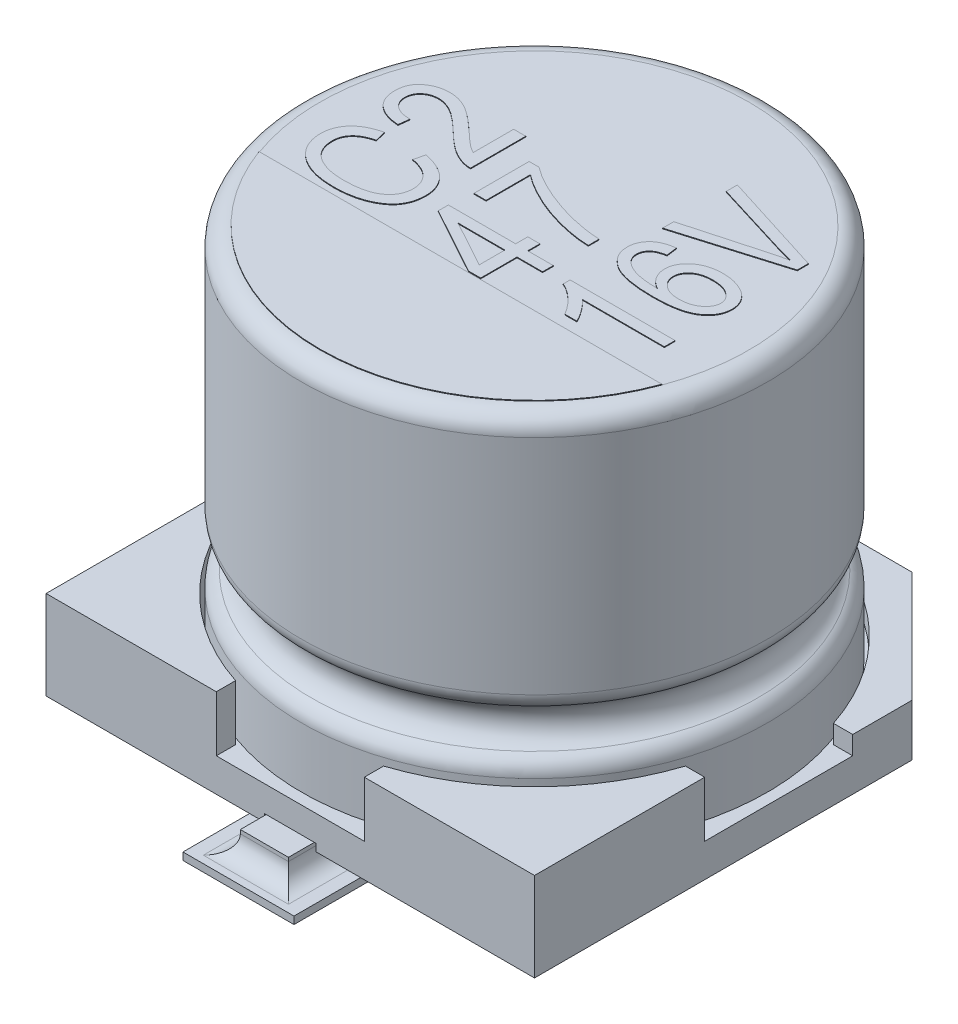
from build123d import *

# Parameters (mm, degrees)
SKETCH1_W                = 6.6
SKETCH1_H                = 6.6
BOSS_EXTRUDE1_DEPTH      = 1.2
CUT_EXTRUDE1_DEPTH       = 0.75
CUT_EXTRUDE2_DEPTH       = 5.902040392
CUT_EXTRUDE2_DEPTH_BACK  = 5.902040392
SKETCH3_W                = 3.3
SKETCH3_H                = 0.5
CHAMFER1_SIZE            = 1.5
CUT_EXTRUDE3_DEPTH       = 0.1
BOSS_EXTRUDE4_DEPTH      = 0.3
BOSS_EXTRUDE4_DEPTH_BACK = 0.1
SKETCH8_R                = 0.5
BOSS_EXTRUDE5_DEPTH      = 0.3
SKETCH9_W                = 1.5
SKETCH9_H                = 2
BOSS_EXTRUDE6_DEPTH      = 0.1
FILLET1_R                = 0.25
BOSS_EXTRUDE7_DEPTH      = 0.01


with BuildPart() as part:
    # Sketch1 → Boss-Extrude1 (new body)
    with BuildSketch(Plane(origin=(0, 0.3, 0), x_dir=(1, 0, 0), z_dir=(0, 1, 0))):
        Rectangle(SKETCH1_W, SKETCH1_H)
    extrude(amount=BOSS_EXTRUDE1_DEPTH)

    # Sketch2 → Cut-Extrude1 (cut)
    with BuildSketch(Plane(origin=(0, 1.5, 0), x_dir=(1, 0, 0), z_dir=(0, 1, 0))):
        with BuildLine():
            Line((-3.3, 1), (-3.039736831, 1))
            ThreePointArc((-3.039736831, 1), (-2.2627417, 2.2627417), (-1, 3.039736831))
            Line((-1, 3.039736831), (-1, 3.3))
            Line((-1, 3.3), (1, 3.3))
            Line((1, 3.3), (1, 3.039736831))
            ThreePointArc((1, 3.039736831), (2.2627417, 2.2627417), (3.039736831, 1))
            Line((3.039736831, 1), (3.3, 1))
            Line((3.3, 1), (3.3, -1))
            Line((3.3, -1), (3.039736831, -1))
            ThreePointArc((3.039736831, -1), (2.2627417, -2.2627417), (1, -3.039736831))
            Line((1, -3.039736831), (1, -3.3))
            Line((1, -3.3), (-1, -3.3))
            Line((-1, -3.3), (-1, -3.039736831))
            ThreePointArc((-1, -3.039736831), (-2.2627417, -2.2627417), (-3.039736831, -1))
            Line((-3.039736831, -1), (-3.3, -1))
            Line((-3.3, -1), (-3.3, 1))
        make_face()
    extrude(amount=-CUT_EXTRUDE1_DEPTH, mode=Mode.SUBTRACT)

    # Sketch3 → Cut-Extrude2 (cut, two sides: drawn at the far end of the back side and taken through both)
    with BuildSketch(Plane(origin=(0, 0, 0), x_dir=(0, 0, -1), z_dir=(1, 0, 0)).offset(-CUT_EXTRUDE2_DEPTH_BACK)):
        with Locations((1.65, 1.25)):
            Rectangle(SKETCH3_W, SKETCH3_H)
    extrude(amount=CUT_EXTRUDE2_DEPTH + CUT_EXTRUDE2_DEPTH_BACK, mode=Mode.SUBTRACT)

    # Chamfer1
    chamfer1_edges = [part.edges().sort_by_distance(p)[0] for p in [
        (-3.3, 0.65, -3.3),
        (3.3, 0.65, -3.3),
    ]]
    chamfer(chamfer1_edges, length=CHAMFER1_SIZE)

    # Sketch7 → Cut-Extrude3 (cut)
    with BuildSketch(Plane.XZ.offset(-0.3)):
        with BuildLine():
            Line((-0.35, 3.3), (0.35, 3.3))
            Line((0.35, 3.3), (0.498675617, 1.261367968))
            ThreePointArc((0.498675617, 1.261367968), (0, 0.725), (-0.498675617, 1.261367968))
            Line((-0.498675617, 1.261367968), (-0.35, 3.3))
        make_face()
        with BuildLine():
            Line((-0.35, -3.3), (0.35, -3.3))
            Line((0.35, -3.3), (0.498675617, -1.261367968))
            ThreePointArc((0.498675617, -1.261367968), (0, -0.725), (-0.498675617, -1.261367968))
            Line((-0.498675617, -1.261367968), (-0.35, -3.3))
        make_face()
    extrude(amount=-CUT_EXTRUDE3_DEPTH, mode=Mode.SUBTRACT)

    # Sketch6 → Boss-Extrude4 (add, two sides: drawn at the far end of the back side and taken through both)
    with BuildSketch(Plane.XZ.offset(-0.3).offset(-BOSS_EXTRUDE4_DEPTH_BACK)):
        with BuildLine():
            Line((-0.325, -1.225), (-0.325, -3.65))
            Line((-0.325, -3.65), (0.325, -3.65))
            Line((0.325, -3.65), (0.325, -1.225))
            ThreePointArc((0.325, -1.225), (0, -0.9), (-0.325, -1.225))
        make_face()
        with BuildLine():
            Line((-0.325, 1.225), (-0.325, 3.65))
            Line((-0.325, 3.65), (0.325, 3.65))
            Line((0.325, 3.65), (0.325, 1.225))
            ThreePointArc((0.325, 1.225), (0, 0.9), (-0.325, 1.225))
        make_face()
    extrude(amount=BOSS_EXTRUDE4_DEPTH + BOSS_EXTRUDE4_DEPTH_BACK)

    # Sketch8 → Boss-Extrude5 (add)
    with BuildSketch(Plane.XZ.offset(-0.3)):
        with Locations((-2, 2)):
            Circle(SKETCH8_R)
        with Locations((2, 2)):
            Circle(SKETCH8_R)
        with Locations((2, -2)):
            Circle(SKETCH8_R)
        with Locations((-2, -2)):
            Circle(SKETCH8_R)
    extrude(amount=BOSS_EXTRUDE5_DEPTH)

    # Sketch9 → Boss-Extrude6 (add)
    with BuildSketch(Plane(origin=(0, 0, 0), x_dir=(1, 0, 0), z_dir=(0, 1, 0))):
        with Locations((0, 3)):
            Rectangle(SKETCH9_W, SKETCH9_H)
        with Locations((0, -3)):
            Rectangle(SKETCH9_W, SKETCH9_H)
    extrude(amount=BOSS_EXTRUDE6_DEPTH)

    # Fillet1
    fillet1_edges = [part.edges().sort_by_distance(p)[0] for p in [
        (-0.325, 0.1, -2.825),
        (0, 0.1, -3.65),
        (0.325, 0.1, -2.825),
        (-0.325, 0.1, 2.825),
        (0.325, 0.1, 2.825),
        (0, 0.1, 3.65),
    ]]
    fillet(fillet1_edges, radius=FILLET1_R)


with BuildPart() as body_2:
    # Sketch4 → Revolve1 (revolve)
    with BuildSketch(Plane(origin=(0, 0, 0), x_dir=(0, 0, -1), z_dir=(1, 0, 0))):
        with BuildLine():
            Line((0, 0.75), (0, 5.8))
            Line((0, 5.8), (-2.9, 5.8))
            ThreePointArc((-2.9, 5.8), (-3.076776695, 5.726776695), (-3.15, 5.55))
            Line((-3.15, 5.55), (-3.15, 2.539897949))
            ThreePointArc((-3.15, 2.539897949), (-3.113200716, 2.409339707), (-3.013636364, 2.317217063))
            ThreePointArc((-3.013636364, 2.317217063), (-2.85, 2.05), (-3.013636364, 1.782782937))
            ThreePointArc((-3.013636364, 1.782782937), (-3.113200716, 1.690660293), (-3.15, 1.560102051))
            Line((-3.15, 1.560102051), (-3.15, 0.75))
            Line((-3.15, 0.75), (0, 0.75))
        make_face()
    revolve(axis=Axis((0, 0, 0), (0, 1, 0)))

    # Sketch10 → Boss-Extrude7 (add)
    # profile 1 of 8: a face of its own
    with BuildSketch(Plane(origin=(0, 5.8, 0), x_dir=(1, 0, 0), z_dir=(0, 1, 0))):
        with BuildLine():
            Line((-2.722131518, -1), (2.722131518, -1))
            ThreePointArc((2.722131518, -1), (0, -2.9), (-2.722131518, -1))
        make_face()
    # profile 2 of 8: a face of its own
    with BuildSketch(Plane(origin=(0, 5.8, 0), x_dir=(1, 0, 0), z_dir=(0, 1, 0))):
        with BuildLine():
            Line((-1.590909091, -0.054545455), (-1.554545455, 0.090909091))
            add(Edge.make_bspline(
                [(-1.554545455, 0.090909091), (-1.535269984, 0.086573907), (-1.497690858, 0.078122106), (-1.443641016, 0.062267336), (-1.39347407, 0.043748021), (-1.347020443, 0.023039775), (-1.304271779, 0.000124477), (-1.26542753, -0.02529249), (-1.230157415, -0.052859494), (-1.199022696, -0.0830881), (-1.1711564, -0.11498153), (-1.147359527, -0.148885394), (-1.126876496, -0.184353775), (-1.110494381, -0.221648338), (-1.097542958, -0.26053486), (-1.088602603, -0.301197149), (-1.082613039, -0.343476895), (-1.082085319, -0.372327427), (-1.081818182, -0.386931818)],
                knots=[0, 0, 0, 0, 1.289353086, 2.513700628, 3.673385124, 4.777321585, 5.831023157, 6.835648429, 7.803886002, 8.748111141, 9.663929382, 10.564264807, 11.447463292, 12.332994627, 13.21843967, 14.118159583, 15.047395907, 16, 16, 16, 16], degree=3))
            add(Edge.make_bspline(
                [(-1.081818182, -0.386931818), (-1.08199604, -0.399821435), (-1.082344685, -0.425088107), (-1.08628588, -0.462271509), (-1.092042775, -0.49811477), (-1.100709737, -0.532535089), (-1.111320422, -0.565607629), (-1.12494552, -0.597015472), (-1.140459369, -0.627260099), (-1.158765073, -0.656028269), (-1.179571172, -0.683485815), (-1.203389889, -0.709483177), (-1.230089597, -0.734193803), (-1.259944493, -0.757429014), (-1.292153583, -0.780002615), (-1.327732387, -0.800693244), (-1.366087752, -0.820236254), (-1.407117451, -0.838589504), (-1.450494312, -0.855557658), (-1.496291355, -0.869438478), (-1.543730677, -0.881811406), (-1.593174601, -0.891633014), (-1.644419194, -0.899736152), (-1.697742163, -0.904867658), (-1.752885478, -0.90849447), (-1.79033462, -0.908889873), (-1.809375, -0.909090909)],
                knots=[0, 0, 0, 0, 0.921073667, 1.805520506, 2.670265093, 3.514196551, 4.340540458, 5.150330323, 5.958760814, 6.76821105, 7.584651584, 8.418448886, 9.285522186, 10.182088649, 11.121025464, 12.095129432, 13.121488672, 14.19720655, 15.30730909, 16.448576387, 17.61598683, 18.810867686, 20.050753221, 21.323199669, 22.639026301, 24, 24, 24, 24], degree=3))
            add(Edge.make_bspline(
                [(-1.809375, -0.909090909), (-1.828131477, -0.908891515), (-1.864918777, -0.908500442), (-1.918927074, -0.904879558), (-1.970836199, -0.89976115), (-2.020467971, -0.891629314), (-2.068038414, -0.881875407), (-2.113230745, -0.869546812), (-2.156417451, -0.855465065), (-2.197183074, -0.838717593), (-2.23556886, -0.819854437), (-2.271703348, -0.799665669), (-2.305636674, -0.7782885), (-2.336754909, -0.754647483), (-2.365716723, -0.729906308), (-2.392050099, -0.703226401), (-2.415889386, -0.675051379), (-2.437612676, -0.645533861), (-2.456445194, -0.614609234), (-2.473168151, -0.582906747), (-2.487044041, -0.550190169), (-2.498446352, -0.516578306), (-2.507309721, -0.482103804), (-2.51340371, -0.446753631), (-2.517701953, -0.410616822), (-2.518020918, -0.386187094), (-2.518181818, -0.373863636)],
                knots=[0, 0, 0, 0, 1.355026576, 2.657629592, 3.909672378, 5.122282177, 6.289750101, 7.416737124, 8.50507279, 9.569838826, 10.598010427, 11.593540646, 12.559644741, 13.492918072, 14.414658006, 15.309728197, 16.19807831, 17.079418121, 17.954841938, 18.811754048, 19.667052977, 20.519555819, 21.374197669, 22.235876869, 23.110096619, 24, 24, 24, 24], degree=3))
            add(Edge.make_bspline(
                [(-2.518181818, -0.373863636), (-2.517836245, -0.360403658), (-2.517157421, -0.333963692), (-2.51232314, -0.2949276), (-2.50375071, -0.257491322), (-2.491963894, -0.221400738), (-2.477319506, -0.186648435), (-2.458926486, -0.153497861), (-2.437231843, -0.121829676), (-2.412151492, -0.091753334), (-2.384064112, -0.063268457), (-2.352642727, -0.037053667), (-2.318021615, -0.013198288), (-2.280592352, 0.008720064), (-2.239836161, 0.028077805), (-2.196104803, 0.045195718), (-2.149383072, 0.060899358), (-2.116737437, 0.06871843), (-2.1, 0.072727273)],
                knots=[0, 0, 0, 0, 0.96928357, 1.904001914, 2.82717962, 3.730829761, 4.635277328, 5.538798787, 6.456240452, 7.39579775, 8.3554607, 9.333438427, 10.337996414, 11.380185464, 12.453917498, 13.583566383, 14.761092973, 16, 16, 16, 16], degree=3))
            Line((-2.1, 0.072727273), (-2.063636364, -0.072727273))
            add(Edge.make_bspline(
                [(-2.063636364, -0.072727273), (-2.075415657, -0.076014842), (-2.09838882, -0.082426589), (-2.131385283, -0.093836475), (-2.16212884, -0.106315751), (-2.190702493, -0.119878322), (-2.216858294, -0.134981345), (-2.240809391, -0.151183398), (-2.262622459, -0.168512213), (-2.281837552, -0.18733177), (-2.299174934, -0.207015726), (-2.314027101, -0.228167261), (-2.326434713, -0.250610755), (-2.336864821, -0.274143399), (-2.344710122, -0.29883956), (-2.350488764, -0.324780444), (-2.353897302, -0.351897099), (-2.354327694, -0.370445051), (-2.354545455, -0.379829545)],
                knots=[0, 0, 0, 0, 1.274827499, 2.486296693, 3.637698816, 4.732866786, 5.781146847, 6.783409552, 7.745577291, 8.681189198, 9.583979081, 10.476943643, 11.369744444, 12.253932728, 13.156290603, 14.066553906, 15.021756508, 16, 16, 16, 16], degree=3))
            add(Edge.make_bspline(
                [(-2.354545455, -0.379829545), (-2.35385919, -0.398352683), (-2.352520049, -0.434497777), (-2.341380909, -0.486774554), (-2.32356338, -0.535415072), (-2.302183567, -0.572435813), (-2.281676826, -0.599884003), (-2.264145966, -0.619341158), (-2.244571744, -0.637656309), (-2.223156065, -0.655079621), (-2.199729148, -0.671452407), (-2.174116674, -0.68659933), (-2.146678058, -0.700674648), (-2.117280199, -0.71391907), (-2.085725363, -0.725452856), (-2.052144458, -0.735658997), (-2.016608107, -0.744497484), (-1.97904312, -0.751570884), (-1.939483915, -0.756840566), (-1.897893335, -0.760900414), (-1.854284805, -0.763081061), (-1.824528656, -0.763448991), (-1.809375, -0.763636364)],
                knots=[0, 0, 0, 0, 1.477150824, 2.882435776, 4.245666297, 5.596604592, 6.276856516, 6.977993226, 7.683799496, 8.414501263, 9.17983833, 9.962775894, 10.787606784, 11.640228058, 12.534608525, 13.467077939, 14.440493086, 15.455932091, 16.516312958, 17.624894552, 18.790450687, 20, 20, 20, 20], degree=3))
            add(Edge.make_bspline(
                [(-1.809375, -0.763636364), (-1.7866406, -0.763277052), (-1.742545554, -0.76258014), (-1.678505163, -0.758136361), (-1.618781, -0.750361716), (-1.56357216, -0.73894853), (-1.512700987, -0.724850823), (-1.466148021, -0.70769878), (-1.424108709, -0.686842239), (-1.3864956, -0.663014636), (-1.353335841, -0.636428646), (-1.324444791, -0.607743969), (-1.300117612, -0.576779572), (-1.279890257, -0.543911532), (-1.264590564, -0.508650459), (-1.253399106, -0.471491449), (-1.246760222, -0.43214949), (-1.24589616, -0.405233711), (-1.245454545, -0.391477273)],
                knots=[0, 0, 0, 0, 1.437104972, 2.787371166, 4.055570009, 5.241294904, 6.348053785, 7.389870239, 8.372351441, 9.308936623, 10.198930124, 11.053953419, 11.87666206, 12.682560998, 13.486679433, 14.299132302, 15.130700221, 16, 16, 16, 16], degree=3))
            add(Edge.make_bspline(
                [(-1.245454545, -0.391477273), (-1.245736078, -0.381236028), (-1.246290868, -0.361054538), (-1.250438864, -0.331302808), (-1.25684292, -0.302519826), (-1.266278016, -0.274802746), (-1.278603487, -0.248317216), (-1.293435518, -0.222915999), (-1.310955246, -0.1985858), (-1.331001303, -0.175372212), (-1.35388971, -0.153621502), (-1.379633959, -0.133728141), (-1.407978223, -0.115505231), (-1.439304302, -0.099629671), (-1.473213821, -0.085434106), (-1.509927287, -0.072944059), (-1.549417404, -0.062419489), (-1.576856124, -0.057212339), (-1.590909091, -0.054545455)],
                knots=[0, 0, 0, 0, 0.928238582, 1.829195527, 2.718541612, 3.598220604, 4.477899596, 5.362883569, 6.261136532, 7.192387853, 8.139765768, 9.118675424, 10.13801499, 11.190128329, 12.298336808, 13.468533125, 14.703488264, 16, 16, 16, 16], degree=3))
        make_face()
    # profile 3 of 8: a face of its own
    with BuildSketch(Plane(origin=(0, 5.8, 0), x_dir=(1, 0, 0), z_dir=(0, 1, 0))):
        with BuildLine():
            Line((-1.263636364, 0.981818182), (-1.1, 0.981818182))
            Line((-1.1, 0.981818182), (-1.1, 0.236363636))
            add(Edge.make_bspline(
                [(-1.1, 0.236363636), (-1.108526139, 0.236329121), (-1.125800237, 0.236259193), (-1.152136122, 0.238584079), (-1.179109616, 0.243360755), (-1.207080544, 0.249460089), (-1.235681047, 0.258108257), (-1.265050018, 0.268695301), (-1.295114638, 0.281186756), (-1.326051768, 0.295814413), (-1.358163014, 0.312902254), (-1.391293946, 0.333544589), (-1.426060056, 0.357133193), (-1.462027805, 0.384239565), (-1.499539059, 0.414376038), (-1.538420082, 0.447691337), (-1.578884511, 0.484046326), (-1.605760934, 0.509953354), (-1.619602273, 0.523295455)],
                knots=[0, 0, 0, 0, 0.672196011, 1.361880106, 2.081368845, 2.831486093, 3.618364569, 4.435734711, 5.292876118, 6.184871288, 7.133796945, 8.159796293, 9.26180684, 10.446293416, 11.710635831, 13.056147575, 14.483918136, 16, 16, 16, 16], degree=3))
            add(Edge.make_bspline(
                [(-1.619602273, 0.523295455), (-1.635637271, 0.538798259), (-1.666511412, 0.568647703), (-1.712098974, 0.610657945), (-1.754472047, 0.648828469), (-1.79439686, 0.682396652), (-1.831329649, 0.711958454), (-1.865217609, 0.737811297), (-1.896829804, 0.758719674), (-1.934026094, 0.781294777), (-1.978307687, 0.802816931), (-2.029924889, 0.821843734), (-2.079823364, 0.834137484), (-2.112720366, 0.835636031), (-2.128693182, 0.836363636)],
                knots=[0, 0, 0, 0, 1.312560889, 2.527233899, 3.64818266, 4.668586789, 5.596397896, 6.432357998, 7.175835261, 7.825761013, 8.992224112, 10.065918602, 11.060925749, 12, 12, 12, 12], degree=3))
            add(Edge.make_bspline(
                [(-2.128693182, 0.836363636), (-2.137511466, 0.836262209), (-2.154734496, 0.836064109), (-2.179886592, 0.832696429), (-2.20381126, 0.827895556), (-2.226676172, 0.821550373), (-2.248124534, 0.812577909), (-2.268306101, 0.801705089), (-2.28748668, 0.78927231), (-2.305000247, 0.774764414), (-2.320799928, 0.758906262), (-2.334944309, 0.74215364), (-2.34650537, 0.724224166), (-2.356081715, 0.705487317), (-2.363408979, 0.685830846), (-2.368899131, 0.665304412), (-2.372018106, 0.643845165), (-2.37248854, 0.629270992), (-2.372727273, 0.621875)],
                knots=[0, 0, 0, 0, 1.164144409, 2.273695819, 3.345940663, 4.387378487, 5.402712487, 6.410231049, 7.41307794, 8.417484468, 9.408318902, 10.367853362, 11.308274301, 12.220303706, 13.142827832, 14.074469365, 15.022846069, 16, 16, 16, 16], degree=3))
            add(Edge.make_bspline(
                [(-2.372727273, 0.621875), (-2.37256065, 0.613900574), (-2.372235395, 0.59833413), (-2.36816798, 0.575651584), (-2.362773189, 0.553892243), (-2.354244328, 0.533328095), (-2.34393617, 0.513567435), (-2.330480705, 0.495423159), (-2.315464229, 0.477851762), (-2.297847597, 0.461699801), (-2.277843958, 0.447282103), (-2.255995759, 0.434340392), (-2.231759102, 0.423909264), (-2.205732976, 0.415143025), (-2.177605795, 0.408257148), (-2.147464409, 0.403659769), (-2.115321715, 0.400286651), (-2.093191418, 0.400097308), (-2.081818182, 0.4)],
                knots=[0, 0, 0, 0, 0.928593091, 1.812656339, 2.680433, 3.537535669, 4.402074609, 5.272376737, 6.164676777, 7.094647554, 8.050991042, 9.035788945, 10.049325173, 11.121325706, 12.235436061, 13.420862991, 14.67452591, 16, 16, 16, 16], degree=3))
            Line((-2.081818182, 0.4), (-2.1, 0.254545455))
            add(Edge.make_bspline(
                [(-2.1, 0.254545455), (-2.116878864, 0.256044403), (-2.149624625, 0.258952431), (-2.197028868, 0.266582878), (-2.241012726, 0.277169397), (-2.282009501, 0.289743194), (-2.319529308, 0.305538117), (-2.354259092, 0.323315632), (-2.385594771, 0.344104712), (-2.41358887, 0.367471303), (-2.438135931, 0.393219601), (-2.459470498, 0.420881428), (-2.477973713, 0.450326621), (-2.492661358, 0.48196961), (-2.504113656, 0.515601078), (-2.512301557, 0.551095677), (-2.517184689, 0.588595521), (-2.517844532, 0.61418989), (-2.518181818, 0.627272727)],
                knots=[0, 0, 0, 0, 1.296016433, 2.514330702, 3.668705393, 4.754684394, 5.790583066, 6.778804856, 7.735156204, 8.660808185, 9.562568342, 10.450784178, 11.329227516, 12.217177451, 13.112894374, 14.042449809, 14.999377131, 16, 16, 16, 16], degree=3))
            add(Edge.make_bspline(
                [(-2.518181818, 0.627272727), (-2.51777024, 0.641399278), (-2.51696883, 0.66890602), (-2.511606791, 0.708928303), (-2.502364468, 0.746367717), (-2.488775473, 0.780952896), (-2.472086687, 0.813059839), (-2.451359855, 0.842398159), (-2.426718946, 0.8689373), (-2.398630231, 0.892533787), (-2.368318477, 0.913392859), (-2.336619301, 0.931592245), (-2.304062219, 0.947379151), (-2.270283829, 0.959716965), (-2.235737761, 0.970020381), (-2.199900262, 0.976493207), (-2.163184854, 0.98105003), (-2.138366747, 0.981560685), (-2.125852273, 0.981818182)],
                knots=[0, 0, 0, 0, 1.141316638, 2.222333051, 3.255980828, 4.24919085, 5.217781249, 6.173073686, 7.14226832, 8.135684626, 9.131102602, 10.111468148, 11.086834621, 12.050425614, 13.014198859, 13.995608887, 14.989290351, 16, 16, 16, 16], degree=3))
            add(Edge.make_bspline(
                [(-2.125852273, 0.981818182), (-2.11457728, 0.981575571), (-2.092174188, 0.98109351), (-2.058747505, 0.977957666), (-2.025770218, 0.972422318), (-1.992925237, 0.965234918), (-1.960721139, 0.955035926), (-1.928646367, 0.943490202), (-1.897063055, 0.92948583), (-1.865353596, 0.912954493), (-1.832400362, 0.893593658), (-1.797582813, 0.870413663), (-1.75999161, 0.843695117), (-1.720068327, 0.812894269), (-1.677371403, 0.778503223), (-1.632239704, 0.74007834), (-1.584581066, 0.697748991), (-1.552225242, 0.667949952), (-1.535511364, 0.652556818)],
                knots=[0, 0, 0, 0, 0.780531358, 1.550893666, 2.321451189, 3.094347453, 3.876089108, 4.657940698, 5.453333384, 6.265487087, 7.132311241, 8.097757185, 9.160053187, 10.324349312, 11.587703087, 12.955031265, 14.427076445, 16, 16, 16, 16], degree=3))
            add(Edge.make_bspline(
                [(-1.535511364, 0.652556818), (-1.525120683, 0.642774978), (-1.505263257, 0.624081097), (-1.476459517, 0.597787932), (-1.450627532, 0.573694445), (-1.427113376, 0.552619595), (-1.406420699, 0.533879053), (-1.387872289, 0.518474586), (-1.372371784, 0.50522937), (-1.347533386, 0.485906517), (-1.312497714, 0.461520393), (-1.279547873, 0.444555837), (-1.263636364, 0.436363636)],
                knots=[0, 0, 0, 0, 1.227426371, 2.345710398, 3.354421158, 4.265580894, 5.061720194, 5.755250507, 6.339260457, 6.815034732, 8.461977265, 10, 10, 10, 10], degree=3))
            Line((-1.263636364, 0.436363636), (-1.263636364, 0.981818182))
        make_face()
    # profile 4 of 8: a face of its own
    with BuildSketch(Plane(origin=(0, 5.8, 0), x_dir=(1, 0, 0), z_dir=(0, 1, 0))):
        Polygon((0.6, -0.490909091), (0.254545455, -0.490909091), (0.254545455, -0.981818182), (0.090909091, -0.981818182), (-0.818181818, -0.482670455), (-0.818181818, -0.345454545), (0.090909091, -0.345454545), (0.090909091, -0.181818182), (0.254545455, -0.181818182), (0.254545455, -0.345454545), (0.6, -0.345454545), align=None)
        Polygon((0.090909091, -0.490909091), (-0.541761364, -0.490909091), (0.090909091, -0.838352273), align=None, mode=Mode.SUBTRACT)
    # profile 5 of 8: a face of its own
    with BuildSketch(Plane(origin=(0, 5.8, 0), x_dir=(1, 0, 0), z_dir=(0, 1, 0))):
        with BuildLine():
            Line((-0.618181818, -0.036363636), (-0.781818182, -0.036363636))
            Line((-0.781818182, -0.036363636), (-0.781818182, 0.709090909))
            Line((-0.781818182, 0.709090909), (-0.648011364, 0.709090909))
            add(Edge.make_bspline(
                [(-0.648011364, 0.709090909), (-0.629493997, 0.695259816), (-0.591802758, 0.667107268), (-0.531511589, 0.627736674), (-0.467300458, 0.589447284), (-0.399115474, 0.552202178), (-0.326735965, 0.516442976), (-0.250395077, 0.481792677), (-0.169863353, 0.448671938), (-0.086180255, 0.416771358), (-0.000509186, 0.387072726), (0.085833546, 0.360699392), (0.172037252, 0.337560436), (0.258041112, 0.318119267), (0.343740707, 0.301430866), (0.429233175, 0.288433289), (0.514618592, 0.278624638), (0.571572289, 0.274690798), (0.6, 0.272727273)],
                knots=[0, 0, 0, 0, 0.828228242, 1.685820058, 2.579325365, 3.507361607, 4.469713273, 5.472243924, 6.511632332, 7.590183537, 8.68180921, 9.76082494, 10.825356942, 11.880104434, 12.920528634, 13.95402052, 14.978775448, 16, 16, 16, 16], degree=3))
            Line((0.6, 0.272727273), (0.6, 0.127272727))
            add(Edge.make_bspline(
                [(0.6, 0.127272727), (0.585031616, 0.127721783), (0.554496113, 0.128637858), (0.507812363, 0.132321595), (0.459263961, 0.136926159), (0.408898623, 0.14395977), (0.356690679, 0.152404131), (0.302660797, 0.16282712), (0.246691588, 0.174269157), (0.169998372, 0.192613669), (0.07400088, 0.218383212), (-0.039052852, 0.255716866), (-0.149665888, 0.297377526), (-0.256248385, 0.345139752), (-0.357722591, 0.395822213), (-0.451901767, 0.449612447), (-0.539097534, 0.503996466), (-0.592310728, 0.544126176), (-0.618181818, 0.563636364)],
                knots=[0, 0, 0, 0, 0.547560405, 1.117023226, 1.712128439, 2.330702075, 2.976322001, 3.646013224, 4.342857794, 5.065247493, 6.529539093, 7.976213993, 9.417556904, 10.850065343, 12.245478746, 13.563746768, 14.815546979, 16, 16, 16, 16], degree=3))
            Line((-0.618181818, 0.563636364), (-0.618181818, -0.036363636))
        make_face()
    # profile 6 of 8: a face of its own
    with BuildSketch(Plane(origin=(0, 5.8, 0), x_dir=(1, 0, 0), z_dir=(0, 1, 0))):
        with BuildLine():
            Line((2.3, -0.4), (2.3, -0.545454545))
            Line((2.3, -0.545454545), (1.190909091, -0.545454545))
            add(Edge.make_bspline(
                [(1.190909091, -0.545454545), (1.201187583, -0.554390899), (1.222489747, -0.572911482), (1.252821972, -0.60494637), (1.283744861, -0.640961759), (1.314142583, -0.680475653), (1.343094492, -0.721004913), (1.369022417, -0.760723301), (1.391194556, -0.798732178), (1.403286622, -0.824158704), (1.409090909, -0.836363636)],
                knots=[0, 0, 0, 0, 0.892632118, 1.84997915, 2.889208393, 4.004565423, 5.117638514, 6.154471911, 7.114131986, 8, 8, 8, 8], degree=3))
            Line((1.409090909, -0.836363636), (1.245454545, -0.836363636))
            add(Edge.make_bspline(
                [(1.245454545, -0.836363636), (1.233642199, -0.816748251), (1.210118652, -0.777685441), (1.169417041, -0.722834292), (1.125143852, -0.671296873), (1.077511838, -0.624163795), (1.028626141, -0.581775948), (0.979606546, -0.545645228), (0.931206448, -0.51592592), (0.897903798, -0.50135576), (0.881818182, -0.494318182)],
                knots=[0, 0, 0, 0, 1.082336866, 2.155405958, 3.2255179, 4.292702086, 5.32152541, 6.282639852, 7.170492597, 8, 8, 8, 8], degree=3))
            Line((0.881818182, -0.494318182), (0.881818182, -0.4))
            Line((0.881818182, -0.4), (2.3, -0.4))
        make_face()
    # profile 7 of 8: a face of its own
    with BuildSketch(Plane(origin=(0, 5.8, 0), x_dir=(1, 0, 0), z_dir=(0, 1, 0))):
        with BuildLine():
            Line((1.227272727, 0.690909091), (1.245454545, 0.545454545))
            add(Edge.make_bspline(
                [(1.245454545, 0.545454545), (1.228888789, 0.542092373), (1.197868713, 0.535796564), (1.155846338, 0.522141027), (1.120711583, 0.506926235), (1.102068626, 0.492856198), (1.093465909, 0.486363636)],
                knots=[0, 0, 0, 0, 1.230211225, 2.30362229, 3.217213433, 4, 4, 4, 4], degree=3))
            add(Edge.make_bspline(
                [(1.093465909, 0.486363636), (1.088151366, 0.481642121), (1.077817659, 0.47246151), (1.06443174, 0.457203296), (1.052895267, 0.441493714), (1.043396289, 0.424973026), (1.036294313, 0.407446484), (1.031211008, 0.389240358), (1.027970319, 0.370378725), (1.02750664, 0.357588599), (1.027272727, 0.351136364)],
                knots=[0, 0, 0, 0, 1.09495211, 2.12904747, 3.12182315, 4.09596367, 5.058329339, 6.028853599, 7.005615717, 8, 8, 8, 8], degree=3))
            add(Edge.make_bspline(
                [(1.027272727, 0.351136364), (1.027643592, 0.341140794), (1.028378351, 0.32133756), (1.036299776, 0.29259891), (1.048194188, 0.265239754), (1.065396873, 0.239642765), (1.087299439, 0.215759119), (1.113695286, 0.193080537), (1.145190329, 0.172459963), (1.1683489, 0.160489366), (1.180397727, 0.154261364)],
                knots=[0, 0, 0, 0, 0.906800098, 1.796553483, 2.691003266, 3.610512055, 4.585978966, 5.630213089, 6.767058994, 8, 8, 8, 8], degree=3))
            add(Edge.make_bspline(
                [(1.180397727, 0.154261364), (1.191962823, 0.149034298), (1.216006909, 0.138167115), (1.255189325, 0.125423701), (1.298133663, 0.114225257), (1.345214897, 0.105828484), (1.395945211, 0.098194453), (1.450776138, 0.093327091), (1.50943165, 0.090145929), (1.549900669, 0.089712047), (1.570738636, 0.089488636)],
                knots=[0, 0, 0, 0, 0.763508889, 1.587351645, 2.476402758, 3.433472996, 4.464603951, 5.563935012, 6.745641893, 8, 8, 8, 8], degree=3))
            add(Edge.make_bspline(
                [(1.570738636, 0.089488636), (1.556560753, 0.097725733), (1.52897336, 0.113753515), (1.492799332, 0.143597703), (1.461338332, 0.17571945), (1.435700878, 0.211098792), (1.41578701, 0.248661976), (1.401491233, 0.287551141), (1.392514241, 0.327527921), (1.391445574, 0.354594227), (1.390909091, 0.368181818)],
                knots=[0, 0, 0, 0, 1.127689085, 2.194262806, 3.218345157, 4.217743143, 5.19231177, 6.137448631, 7.064978137, 8, 8, 8, 8], degree=3))
            add(Edge.make_bspline(
                [(1.390909091, 0.368181818), (1.391301908, 0.37947435), (1.392076125, 0.401731205), (1.397935225, 0.434574693), (1.407678703, 0.46619161), (1.421078749, 0.496875415), (1.438700941, 0.526321122), (1.459989424, 0.55473775), (1.485384314, 0.581768718), (1.513778366, 0.607887329), (1.545762775, 0.631597453), (1.580606808, 0.652393143), (1.617945468, 0.67013848), (1.658109338, 0.68422275), (1.700620967, 0.695643016), (1.74586758, 0.703570359), (1.793660139, 0.708012019), (1.826411295, 0.708725543), (1.843181818, 0.709090909)],
                knots=[0, 0, 0, 0, 0.860357646, 1.695709716, 2.533583491, 3.377064945, 4.241047709, 5.143225219, 6.077846286, 7.063889573, 8.080111547, 9.106229702, 10.152257742, 11.225204373, 12.345649275, 13.503769734, 14.721782881, 16, 16, 16, 16], degree=3))
            add(Edge.make_bspline(
                [(1.843181818, 0.709090909), (1.865940629, 0.708510813), (1.910522693, 0.707374467), (1.975798442, 0.697853255), (2.037715145, 0.681816353), (2.086798735, 0.663659874), (2.123564453, 0.646174993), (2.149231877, 0.632320376), (2.172901252, 0.617317941), (2.195178857, 0.602033393), (2.214942951, 0.584975548), (2.233426741, 0.567774568), (2.249571641, 0.549145547), (2.268698238, 0.523655154), (2.28874725, 0.490162677), (2.30557452, 0.447135236), (2.316278443, 0.402226709), (2.317544283, 0.371460964), (2.318181818, 0.355965909)],
                knots=[0, 0, 0, 0, 1.657594599, 3.247049531, 4.793269837, 6.310589185, 7.051271314, 7.758283223, 8.434037218, 9.092523529, 9.724148541, 10.334150818, 10.930619913, 11.517069014, 12.655365671, 13.76103642, 14.872354135, 16, 16, 16, 16], degree=3))
            add(Edge.make_bspline(
                [(2.318181818, 0.355965909), (2.317691664, 0.342010757), (2.316727601, 0.314562996), (2.309050836, 0.274378579), (2.296867201, 0.236064049), (2.27958791, 0.199563657), (2.257265816, 0.164973364), (2.229710866, 0.132591642), (2.197512918, 0.10196948), (2.160507284, 0.073047837), (2.117363709, 0.047045263), (2.067941211, 0.024355548), (2.011839884, 0.005399942), (1.94919517, -0.009536), (1.880148929, -0.021787042), (1.804634104, -0.030399859), (1.722513582, -0.035469899), (1.665632603, -0.036058055), (1.636079545, -0.036363636)],
                knots=[0, 0, 0, 0, 0.76079261, 1.49636878, 2.22335124, 2.948937493, 3.692613516, 4.462506464, 5.262670056, 6.113081641, 7.019393936, 8.004001644, 9.074018115, 10.244225697, 11.513927426, 12.897326774, 14.387976403, 16, 16, 16, 16], degree=3))
            add(Edge.make_bspline(
                [(1.636079545, -0.036363636), (1.603305255, -0.036094702), (1.540170663, -0.035576643), (1.449090047, -0.030014357), (1.365309726, -0.021600486), (1.288866255, -0.009061535), (1.219622777, 0.006472035), (1.157689709, 0.026126761), (1.102740274, 0.048688873), (1.055355342, 0.075814664), (1.014476479, 0.105480524), (0.97930089, 0.137249763), (0.949000925, 0.170571279), (0.924311914, 0.206245054), (0.905466497, 0.244219922), (0.891582235, 0.283958428), (0.883542405, 0.325909704), (0.882398812, 0.354511992), (0.881818182, 0.369034091)],
                knots=[0, 0, 0, 0, 1.648729313, 3.176021509, 4.589257728, 5.883210501, 7.07130447, 8.156186091, 9.149022935, 10.053769316, 10.896205842, 11.685573168, 12.434569159, 13.157455576, 13.86058765, 14.561213295, 15.269491877, 16, 16, 16, 16], degree=3))
            add(Edge.make_bspline(
                [(0.881818182, 0.369034091), (0.88211765, 0.379555387), (0.88270796, 0.400294916), (0.886582427, 0.430807456), (0.893814712, 0.459878127), (0.903566333, 0.487625163), (0.915663578, 0.514288677), (0.931219954, 0.539251809), (0.949252006, 0.563066082), (0.969992985, 0.585418625), (0.993267363, 0.6063684), (1.019605328, 0.624677841), (1.04811713, 0.641196369), (1.079013501, 0.655861124), (1.11254524, 0.667933113), (1.148573562, 0.677796225), (1.186975614, 0.685905338), (1.21360504, 0.689211954), (1.227272727, 0.690909091)],
                knots=[0, 0, 0, 0, 0.965466884, 1.903123866, 2.815643703, 3.708762019, 4.59904389, 5.49616866, 6.401586744, 7.336219343, 8.290161022, 9.268947462, 10.273430203, 11.311221761, 12.402489703, 13.538768752, 14.73676065, 16, 16, 16, 16], degree=3))
        make_face()
        with BuildLine():
            add(Edge.make_bspline(
                [(1.837784091, 0.109090909), (1.850102241, 0.109299566), (1.874125052, 0.109706487), (1.90926333, 0.113153393), (1.942538217, 0.118929419), (1.974140993, 0.126260744), (2.003549298, 0.136806756), (2.031395969, 0.148861304), (2.057161391, 0.163737555), (2.08105205, 0.180441229), (2.102391824, 0.198691241), (2.121071193, 0.217945946), (2.137105456, 0.237680349), (2.149972193, 0.258474392), (2.160460141, 0.2797765), (2.167444219, 0.302118458), (2.171929301, 0.325009273), (2.172460461, 0.340509441), (2.172727273, 0.348295455)],
                knots=[0, 0, 0, 0, 1.295915113, 2.527288866, 3.709970359, 4.848208075, 5.935365449, 6.992568332, 8.036874269, 9.05966364, 10.056099687, 10.986214356, 11.87941223, 12.725402229, 13.554321318, 14.370446187, 15.18144582, 16, 16, 16, 16], degree=3))
            add(Edge.make_bspline(
                [(2.172727273, 0.348295455), (2.172428819, 0.355224503), (2.17183519, 0.369006472), (2.167840785, 0.389330113), (2.16075589, 0.408891414), (2.151411533, 0.428068793), (2.139004698, 0.446609612), (2.123928734, 0.464502475), (2.105983244, 0.481521888), (2.086082333, 0.498395968), (2.063343969, 0.513403563), (2.038940857, 0.527460465), (2.011901072, 0.538178344), (1.98325262, 0.547808023), (1.9522647, 0.554632144), (1.919498862, 0.560257618), (1.884510312, 0.562846113), (1.860608561, 0.563367677), (1.848295455, 0.563636364)],
                knots=[0, 0, 0, 0, 0.772713955, 1.536938285, 2.298458163, 3.087170851, 3.910203315, 4.779624773, 5.690759825, 6.665637977, 7.684919877, 8.72499675, 9.799719792, 10.921806825, 12.09248587, 13.333813582, 14.6265008, 16, 16, 16, 16], degree=3))
            add(Edge.make_bspline(
                [(1.848295455, 0.563636364), (1.836264519, 0.563378694), (1.812926375, 0.562878854), (1.778827026, 0.560144934), (1.746928488, 0.555059652), (1.716950204, 0.548000868), (1.689270215, 0.538572416), (1.663343495, 0.527586851), (1.639717147, 0.514105651), (1.618159085, 0.498918332), (1.599216622, 0.481977261), (1.582134848, 0.464548352), (1.568406824, 0.445533005), (1.556309172, 0.426225205), (1.547712381, 0.405496771), (1.540886755, 0.384081266), (1.537339548, 0.361574158), (1.536690406, 0.346316734), (1.536363636, 0.338636364)],
                knots=[0, 0, 0, 0, 1.34413917, 2.607420863, 3.817865127, 4.949372023, 6.043265408, 7.080878207, 8.089894499, 9.076140083, 10.020536592, 10.925912695, 11.795477937, 12.63545564, 13.464706931, 14.294565263, 15.141508349, 16, 16, 16, 16], degree=3))
            add(Edge.make_bspline(
                [(1.536363636, 0.338636364), (1.536521087, 0.331038772), (1.536832376, 0.316017883), (1.541156161, 0.294055218), (1.54724935, 0.272677347), (1.556619773, 0.252254121), (1.567906744, 0.232229942), (1.581976203, 0.213112913), (1.598667163, 0.194885761), (1.617544914, 0.177333509), (1.638690326, 0.161235469), (1.661887902, 0.147150406), (1.686968214, 0.135676941), (1.713632566, 0.12588541), (1.742135426, 0.11819808), (1.772469164, 0.112915065), (1.804573655, 0.109766108), (1.826507858, 0.109320165), (1.837784091, 0.109090909)],
                knots=[0, 0, 0, 0, 0.863336265, 1.706866888, 2.538958102, 3.388184842, 4.257154246, 5.151813003, 6.08274342, 7.06663784, 8.081968542, 9.102321145, 10.14869887, 11.215962244, 12.332381785, 13.503694224, 14.716665185, 16, 16, 16, 16], degree=3))
        make_face(mode=Mode.SUBTRACT)
    # profile 8 of 8: a face of its own
    with BuildSketch(Plane(origin=(0, 5.8, 0), x_dir=(1, 0, 0), z_dir=(0, 1, 0))):
        with BuildLine():
            Line((2.3, 1.250852273), (0.9, 0.832102273))
            Line((0.9, 0.832102273), (0.9, 0.981818182))
            Line((0.9, 0.981818182), (1.915625, 1.261931818))
            add(Edge.make_bspline(
                [(1.915625, 1.261931818), (1.93502513, 1.267188611), (1.973113627, 1.277509333), (2.029419911, 1.291882434), (2.083540048, 1.305617864), (2.119023676, 1.314057553), (2.136363636, 1.318181818)],
                knots=[0, 0, 0, 0, 1.058778416, 2.078711773, 3.061114545, 4, 4, 4, 4], degree=3))
            add(Edge.make_bspline(
                [(2.136363636, 1.318181818), (2.100128509, 1.327526981), (2.026165891, 1.346602192), (1.952964299, 1.368417642), (1.915625, 1.379545455)],
                knots=[0, 0, 0, 0, 0.979822753, 2, 2, 2, 2], degree=3))
            Line((1.915625, 1.379545455), (0.9, 1.690909091))
            Line((0.9, 1.690909091), (0.9, 1.842045455))
            Line((0.9, 1.842045455), (2.3, 1.401136364))
            Line((2.3, 1.401136364), (2.3, 1.250852273))
        make_face()
    extrude(amount=BOSS_EXTRUDE7_DEPTH)


solid = Compound([part.part, body_2.part])
